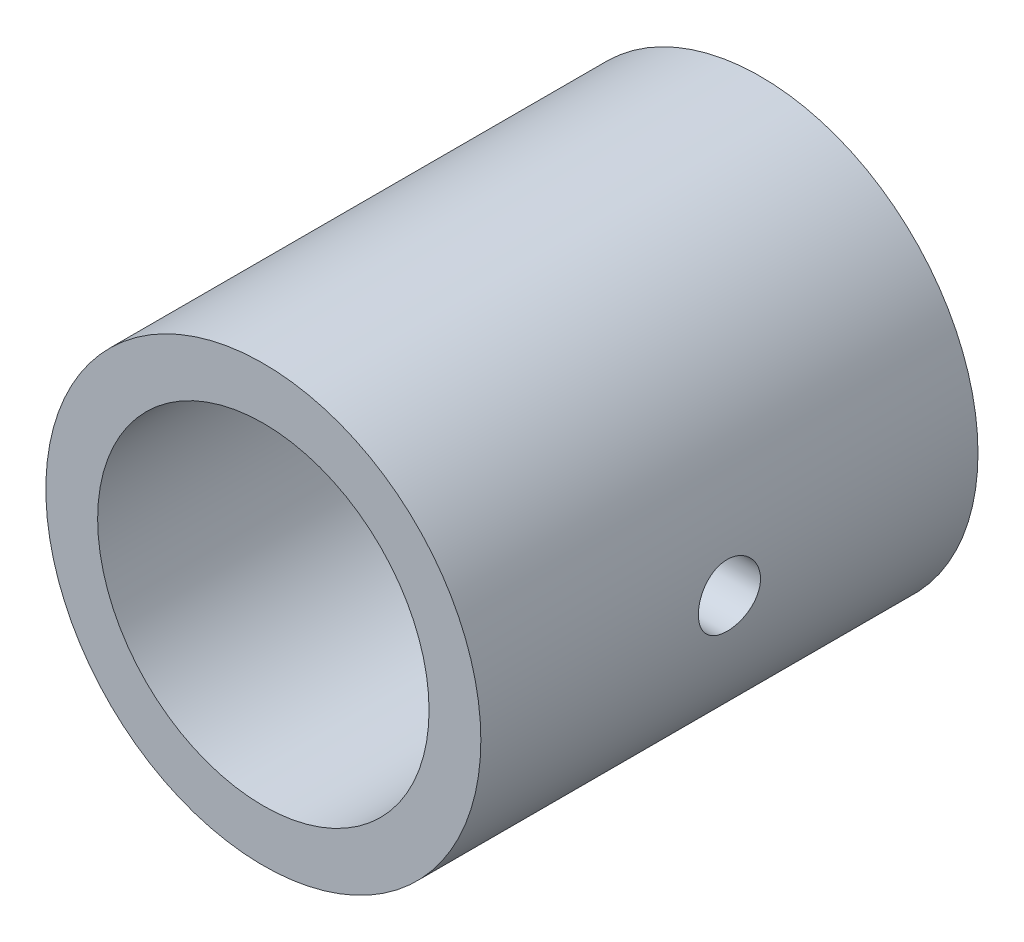
from build123d import *

# Parameters (mm, degrees)
SKETCH1_R               = 5.25
BOSS_EXTRUDE1_DEPTH     = 12
SKETCH2_R               = 4
CUT_EXTRUDE1_DEPTH      = 15
CUT_EXTRUDE2_DEPTH      = 15.111165792
CUT_EXTRUDE2_DEPTH_BACK = 15.111165792
SKETCH3_R               = 0.75


with BuildPart() as part:
    # Sketch1 → Boss-Extrude1 (new body)
    with BuildSketch(Plane.XY):
        Circle(SKETCH1_R)
    extrude(amount=BOSS_EXTRUDE1_DEPTH)

    # Sketch2 → Cut-Extrude1 (cut)
    with BuildSketch(Plane.XY.offset(12)):
        Circle(SKETCH2_R)
    extrude(amount=-CUT_EXTRUDE1_DEPTH, mode=Mode.SUBTRACT)

    # Sketch3 → Cut-Extrude2 (cut, two sides: drawn at the far end of the back side and taken through both)
    with BuildSketch(Plane(origin=(0, 0, 0), x_dir=(0, 0, -1), z_dir=(1, 0, 0)).offset(-CUT_EXTRUDE2_DEPTH_BACK)):
        with Locations((-6, 0)):
            Circle(SKETCH3_R)
    extrude(amount=CUT_EXTRUDE2_DEPTH + CUT_EXTRUDE2_DEPTH_BACK, mode=Mode.SUBTRACT)


solid = part.part
